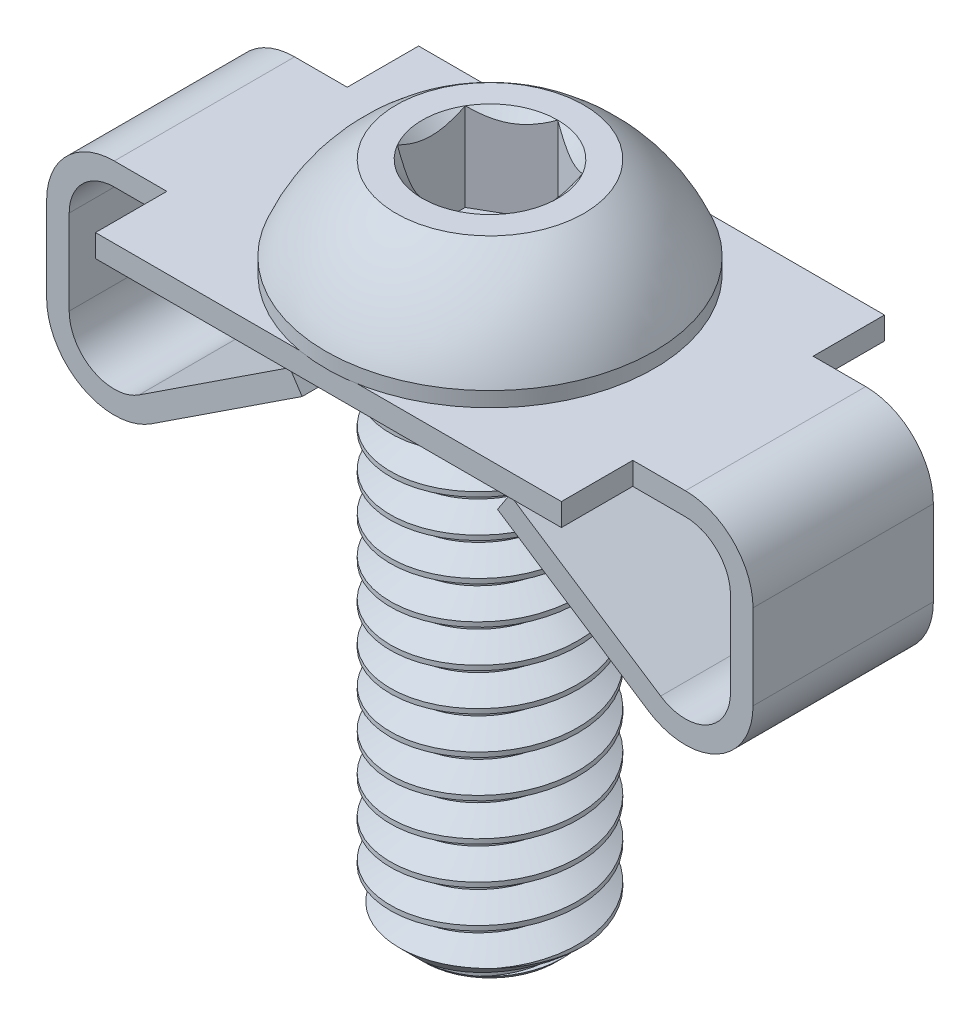
from build123d import *

# Parameters (mm, degrees)
SKETCH1_R           = 3.175
BOSS_EXTRUDE1_DEPTH = 19.05
CUT_SWEEP1_PITCH    = 1.27
SKETCH4_OUTSIDE_W   = 15.102
SKETCH4_OUTSIDE_H   = 15.102
SKETCH4_OUTSIDE_R   = 2.21262927
CUT_EXTRUDE1_DEPTH  = 1.27
CUT_EXTRUDE1_DRAFT  = -45
CUT_EXTRUDE2_DEPTH  = 2.9765625
BOSS_EXTRUDE2_DEPTH = 5.461
SKETCH9_R           = 3.175
CUT_EXTRUDE4_DEPTH  = 24.156418957
CUT_EXTRUDE5_START  = 3.048
CUT_EXTRUDE5_DEPTH  = 21.108418957


with BuildPart() as part:
    # Sketch1 → Boss-Extrude1 (new body)
    with BuildSketch(Plane(origin=(0, 0, 0), x_dir=(1, 0, 0), z_dir=(0, 1, 0))):
        with Locations(Location((0, 0, 0), (0, 0, 270))):
            Circle(SKETCH1_R)
    extrude(amount=-BOSS_EXTRUDE1_DEPTH)

    # Cut-Sweep1: the profile of Sketch3 screwed along a right-hand helix of 16 turns, 8 arcs to a turn; built about Z, then put on its axis
    cut_sweep1_z = Axis((0, 0, 0), (0, 0, 1))
    cut_sweep1_corners = [(2.350110803, 0, -0.47625), (3.243740766, 0, 0.0396875), (3.243740766, 0, -1.1509375), (2.350110803, 0, -0.635)]
    with BuildLine(mode=Mode.PRIVATE) as cut_sweep1_profile:
        Line(cut_sweep1_corners[0], cut_sweep1_corners[1])
        Line(cut_sweep1_corners[1], cut_sweep1_corners[2])
        Line(cut_sweep1_corners[2], cut_sweep1_corners[3])
        Line(cut_sweep1_corners[3], cut_sweep1_corners[0])
    cut_sweep1_cap = Face(cut_sweep1_profile.wire())
    cut_sweep1_turn_angles = [0, 22.5, 45, 67.5, 90, 112.5, 135, 157.5, 180, 202.5, 225, 247.5, 270, 292.5, 315, 337.5, 360]
    cut_sweep1_turn_weights = [1, 0.9238795325112867, 1, 0.9238795325112867, 1, 0.9238795325112867, 1, 0.9238795325112867, 1, 0.9238795325112867, 1, 0.9238795325112867, 1, 0.9238795325112867, 1, 0.9238795325112867, 1]
    cut_sweep1_turn_rails = [Edge.make_bspline([Vector(p[0], p[1], 0).rotate(cut_sweep1_z, cut_sweep1_turn_angles[k]) / cut_sweep1_turn_weights[k] + Vector(0, 0, p[2] + CUT_SWEEP1_PITCH * cut_sweep1_turn_angles[k] / 360) for k in range(17)], [0, 0, 0, 1, 1, 2, 2, 3, 3, 4, 4, 5, 5, 6, 6, 7, 7, 8, 8, 8], 2, cut_sweep1_turn_weights) for p in cut_sweep1_corners]
    cut_sweep1_turn_sides = [Face.make_surface_from_curves(cut_sweep1_turn_rails[p[0]], cut_sweep1_turn_rails[p[1]]) for p in [(0, 1), (1, 2), (2, 3), (3, 0)]]
    cut_sweep1 = Plane(origin=(0, -19.05, 0), x_dir=(0, 0, -1), z_dir=(0, 1, 0)) * Solid(Shell([*[p.moved(Location((0, 0, CUT_SWEEP1_PITCH * i))) for i in range(16) for p in cut_sweep1_turn_sides], cut_sweep1_cap, cut_sweep1_cap.rotate(cut_sweep1_z, 5760).moved(Location((0, 0, CUT_SWEEP1_PITCH * 5760 / 360)))]))
    add(cut_sweep1, mode=Mode.SUBTRACT)


with BuildPart() as cut_extrude1_tool:
    # Sketch4 outside → Cut-Extrude1 (with draft: the straight prism first)
    with BuildSketch(Plane.XZ.offset(19.05)):
        Rectangle(SKETCH4_OUTSIDE_W, SKETCH4_OUTSIDE_H)
        Circle(SKETCH4_OUTSIDE_R, mode=Mode.SUBTRACT)
    extrude(amount=-CUT_EXTRUDE1_DEPTH)
    # Cut-Extrude1: the draft: its side faces are tilted about the plane it starts from
    cut_extrude1_sides = [cut_extrude1_tool.faces().sort_by_distance(p)[0] for p in [
        (0, -18.415, -7.551),
        (7.551, -18.415, 0),
        (0, -18.415, 7.551),
        (-7.551, -18.415, 0),
        (-2.21262927, -18.415, 0),
    ]]
    draft(cut_extrude1_sides, Plane.XZ.offset(19.05), CUT_EXTRUDE1_DRAFT)


with BuildPart() as part_1:
    add(part.part)

    # Cut-Extrude1: cut by cut_extrude1_tool
    add(cut_extrude1_tool.part, mode=Mode.SUBTRACT)

    # Sketch5 → Revolve1 (revolve)
    with BuildSketch(Plane.XY, mode=Mode.PRIVATE) as revolve1_sk:
        with BuildLine():
            Line((0, 0), (0, 3.3528))
            Line((0, 3.3528), (-3.175, 3.3528))
            ThreePointArc((-3.175, 3.3528), (-4.58927271, 2.116878925), (-5.5499, 0.50292))
            Line((-5.5499, 0.50292), (-5.5499, 0))
            Line((-5.5499, 0), (0, 0))
        make_face()
    revolve(revolve1_sk.sketch.rotate(Axis((0, 0, 0), (0, -1, 0)), 90), axis=Axis((0, 0, 0), (0, -1, 0)))

    # Sketch6 → Cut-Extrude2 (cut)
    with BuildSketch(Plane(origin=(0, 3.3528, 0), x_dir=(1, 0, 0), z_dir=(0, 1, 0))):
        Polygon((0, 2.291358881), (-1.984375, 1.14567944), (-1.984375, -1.14567944), (0, -2.291358881), (1.984375, -1.14567944), (1.984375, 1.14567944), align=None)
    extrude(amount=-CUT_EXTRUDE2_DEPTH, mode=Mode.SUBTRACT)

    # Cut-Extrude3 cone 1 section (through the dimple's axis) → Cut-Extrude3 (revolve, cut)
    with BuildSketch(Plane(origin=(0, 3.3528, 0), x_dir=(0, 0, 1), z_dir=(1, 0, 0))):
        Polygon((0, 0), (2.291358881, 0), (0, 2.291358881), align=None)
    revolve(axis=Axis((0, 3.3528, 0), (0, -1, 0)), mode=Mode.SUBTRACT)


with BuildPart() as body_2:
    # Sketch8 → Boss-Extrude2 (new, symmetric)
    with BuildSketch(Plane.XY):
        with BuildLine():
            Line((-9.652, 0), (9.652, 0))
            ThreePointArc((9.652, 0), (11.268446102, -0.669553898), (11.938, -2.286))
            Line((11.938, -2.286), (11.938, -5.1562))
            ThreePointArc((11.938, -5.1562), (10.737658306, -7.167950989), (8.397193314, -7.067026046))
            Line((8.397193314, -7.067026046), (3.302, -3.7211))
            Line((3.302, -3.7211), (3.720268895, -3.084157985))
            Line((3.720268895, -3.084157985), (8.815462209, -6.430084031))
            ThreePointArc((8.815462209, -6.430084031), (10.375772204, -6.497367326), (11.176, -5.1562))
            Line((11.176, -5.1562), (11.176, -2.286))
            ThreePointArc((11.176, -2.286), (10.729630735, -1.208369265), (9.652, -0.762))
            Line((9.652, -0.762), (-9.652, -0.762))
            ThreePointArc((-9.652, -0.762), (-10.729630735, -1.208369265), (-11.176, -2.286))
            Line((-11.176, -2.286), (-11.176, -5.1562))
            ThreePointArc((-11.176, -5.1562), (-10.375772204, -6.497367326), (-8.815462209, -6.430084031))
            Line((-8.815462209, -6.430084031), (-3.720268895, -3.084157985))
            Line((-3.720268895, -3.084157985), (-3.302, -3.7211))
            Line((-3.302, -3.7211), (-8.397193314, -7.067026046))
            ThreePointArc((-8.397193314, -7.067026046), (-10.737658306, -7.167950989), (-11.938, -5.1562))
            Line((-11.938, -5.1562), (-11.938, -2.286))
            ThreePointArc((-11.938, -2.286), (-11.268446102, -0.669553898), (-9.652, 0))
        make_face()
    extrude(amount=BOSS_EXTRUDE2_DEPTH, both=True)

    # Sketch9 → Cut-Extrude4 (cut, through all)
    with BuildSketch(Plane(origin=(0, 0, 0), x_dir=(-1, 0, 0), z_dir=(0, 1, 0))):
        with Locations(Location((0, 0, 0), (0, 0, 90))):
            Circle(SKETCH9_R)
    extrude(amount=-CUT_EXTRUDE4_DEPTH, mode=Mode.SUBTRACT)

    # Sketch10 → Cut-Extrude5 (cut, through all)
    with BuildSketch(Plane.XY.offset(CUT_EXTRUDE5_START)):
        with BuildLine():
            Line((-7.874, 0), (-7.874, -0.762))
            Line((-7.874, -0.762), (-9.652, -0.762))
            ThreePointArc((-9.652, -0.762), (-10.729630735, -1.208369265), (-11.176, -2.286))
            Line((-11.176, -2.286), (-11.176, -5.1562))
            ThreePointArc((-11.176, -5.1562), (-10.375772204, -6.497367326), (-8.815462209, -6.430084031))
            Line((-8.815462209, -6.430084031), (-3.720268895, -3.084157985))
            Line((-3.720268895, -3.084157985), (-3.302, -3.7211))
            Line((-3.302, -3.7211), (-8.397193314, -7.067026046))
            ThreePointArc((-8.397193314, -7.067026046), (-10.737658306, -7.167950989), (-11.938, -5.1562))
            Line((-11.938, -5.1562), (-11.938, -2.286))
            ThreePointArc((-11.938, -2.286), (-11.268446102, -0.669553898), (-9.652, 0))
            Line((-9.652, 0), (-7.874, 0))
        make_face()
        with BuildLine():
            Line((7.874, 0), (7.874, -0.762))
            Line((7.874, -0.762), (9.652, -0.762))
            ThreePointArc((9.652, -0.762), (10.729630735, -1.208369265), (11.176, -2.286))
            Line((11.176, -2.286), (11.176, -5.1562))
            ThreePointArc((11.176, -5.1562), (10.375772204, -6.497367326), (8.815462209, -6.430084031))
            Line((8.815462209, -6.430084031), (3.720268895, -3.084157985))
            Line((3.720268895, -3.084157985), (3.302, -3.7211))
            Line((3.302, -3.7211), (8.397193314, -7.067026046))
            ThreePointArc((8.397193314, -7.067026046), (10.737658306, -7.167950989), (11.938, -5.1562))
            Line((11.938, -5.1562), (11.938, -2.286))
            ThreePointArc((11.938, -2.286), (11.268446102, -0.669553898), (9.652, 0))
            Line((9.652, 0), (7.874, 0))
        make_face()
    cut_extrude5 = extrude(amount=CUT_EXTRUDE5_DEPTH, mode=Mode.SUBTRACT)

    # Mirror1: Cut-Extrude5 across plane
    add(cut_extrude5.mirror(Plane.XY), mode=Mode.SUBTRACT)


solid = Compound([part_1.part, body_2.part])
